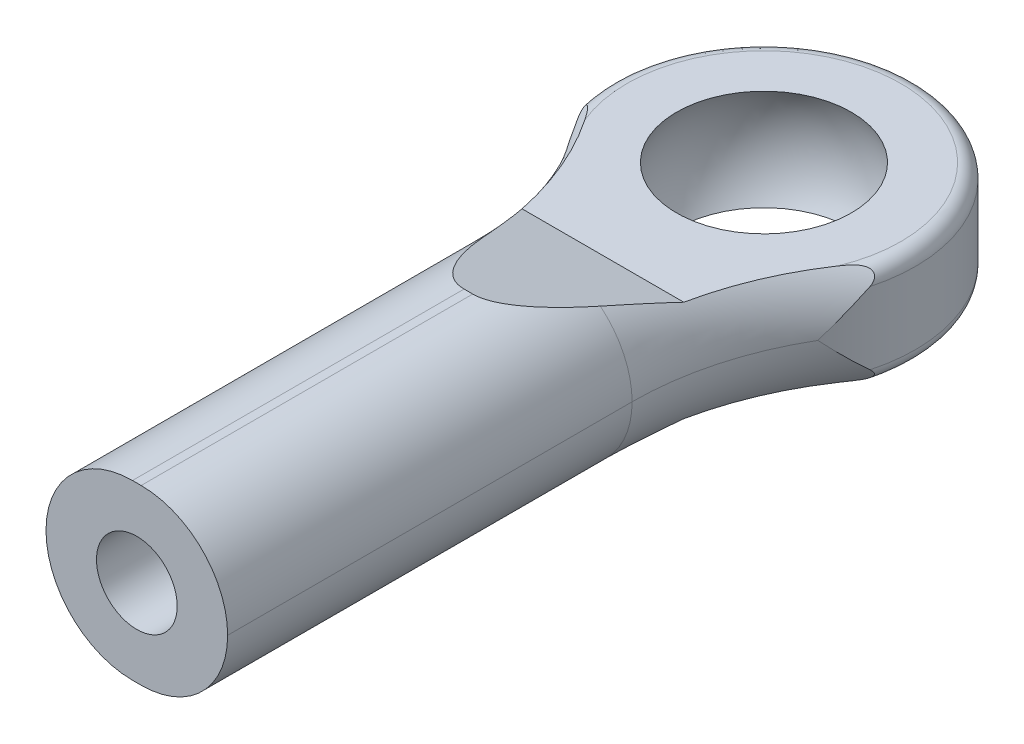
from build123d import *

# Parameters (mm, degrees)
BOSS_EXTRUDE1_DEPTH = 3
CUT_EXTRUDE1_START  = -1.25
CUT_EXTRUDE1_DEPTH  = 1.25
FILLET2_R           = 10
CHAMFER1_SIZE       = 5
CHAMFER1_SIZE_2     = 1.339745962
FILLET3_START       = 7.722693831
FILLET3_DEPTH       = 14.027306169
FILLET3_2_ANGLE     = 41.120463
FILLET3_3_ANGLE     = 41.120463
FILLET4_R           = 0.5
SKETCH10_R          = 1.4
CUT_EXTRUDE3_DEPTH  = 10


with BuildPart() as part:
    # Sketch1 → Boss-Extrude1 (new body)
    with BuildSketch(Plane(origin=(0, 0, 0), x_dir=(1, 0, 0), z_dir=(0, 1, 0))):
        with BuildLine():
            Line((-3.15, -4.2), (-3.15, -21.75))
            Line((-3.15, -21.75), (3.15, -21.75))
            Line((3.15, -21.75), (3.15, -4.2))
            ThreePointArc((3.15, -4.2), (0, 5.25), (-3.15, -4.2))
        make_face()
    extrude(amount=BOSS_EXTRUDE1_DEPTH)

    # Sketch2 → Cut-Extrude1 (cut)
    with BuildSketch(Plane(origin=(0, 3, 0), x_dir=(1, 0, 0), z_dir=(0, 1, 0)).offset(CUT_EXTRUDE1_START)):
        with BuildLine():
            Line((-3.15, -4.2), (-3.15, -5.25))
            Line((-3.15, -5.25), (3.15, -5.25))
            Line((3.15, -5.25), (3.15, -4.2))
            ThreePointArc((3.15, -4.2), (0, 5.25), (-3.15, -4.2))
        make_face()
    extrude(amount=CUT_EXTRUDE1_DEPTH, mode=Mode.SUBTRACT)

    # Cut-Sweep1: sweep along a path in Sketch9
    with BuildLine(Plane(origin=(0, 0, 0), x_dir=(1, 0, 0), z_dir=(0, 1, 0))) as cut_sweep1_path:
        CenterArc((0, 0), 3.5, 0, 360)
    # Sketch8 → Cut-Sweep1 (sweep, cut)
    with BuildSketch(Plane(origin=(0, 0, 0), x_dir=(0, 0, -1), z_dir=(1, 0, 0))):
        with BuildLine():
            Line((0, 3.5), (0, 0))
            Line((0, 0), (3.5, 0))
            ThreePointArc((3.5, 0), (2.474873734, 2.474873734), (0, 3.5))
        make_face()
    sweep(path=cut_sweep1_path.line, mode=Mode.SUBTRACT)

    # Fillet2
    # the kernel refuses this fillet: 10 mm, written as the material it adds along each edge
    with BuildSketch(Plane(origin=(-3.15, 0, 4.2), x_dir=(0, 0, 1), z_dir=(0, 1, 0))) as fillet2_piece_1_section:
        with BuildLine():
            CenterArc((3.522693831, -10), FILLET2_R, 90, 30.424740483)
            ThreePointArc((-1.541367698, -1.37704918), (-0.702247096, -0.765127664), (0, 0))
            Line((0, 0), (3.522693831, 0))
        make_face()
    fillet2_piece_1 = extrude(amount=1.75, mode=Mode.PRIVATE)
    fillet2_piece_1 = split(fillet2_piece_1, bisect_by=Plane(origin=(-3.15, 0, 5.25), z_dir=(0, 0, 1)), keep=Keep.TOP, mode=Mode.PRIVATE)
    add(fillet2_piece_1)
    with BuildSketch(Plane(origin=(-3.15, 0, 4.2), x_dir=(0, 0, 1), z_dir=(0, 1, 0))) as fillet2_piece_2_section:
        with BuildLine():
            CenterArc((3.522693831, -10), FILLET2_R, 90, 30.424740483)
            ThreePointArc((-1.541367698, -1.37704918), (-0.702247096, -0.765127664), (0, 0))
            Line((0, 0), (3.522693831, 0))
        make_face()
    fillet2_piece_2 = extrude(amount=1.75, mode=Mode.PRIVATE)
    fillet2_piece_2 = split(fillet2_piece_2, bisect_by=Plane(origin=(-3.15, 0, 5.25), z_dir=(0, 0, -1)), keep=Keep.TOP, mode=Mode.PRIVATE)
    add(fillet2_piece_2)
    with BuildSketch(Plane(origin=(-3.15, 0, 4.2), x_dir=(0, 0, 1), z_dir=(0, 1, 0))) as fillet2_piece_3_section:
        with BuildLine():
            CenterArc((3.522693831, -10), FILLET2_R, 90, 30.424740483)
            ThreePointArc((-1.541367698, -1.37704918), (-0.702247096, -0.765127664), (0, 0))
            Line((0, 0), (3.522693831, 0))
        make_face()
    fillet2_piece_3 = extrude(amount=10.556734576, mode=Mode.PRIVATE)
    fillet2_piece_3 = split(fillet2_piece_3, bisect_by=Plane(origin=(-3.15, 3, 4.2), z_dir=(0, -1, 0)), keep=Keep.TOP, mode=Mode.PRIVATE)
    fillet2_piece_3 = split(fillet2_piece_3, bisect_by=Plane(origin=(-3.15, 0, 5.25), z_dir=(0, 0, 1)), keep=Keep.TOP, mode=Mode.PRIVATE)
    fillet2_piece_3 = split(fillet2_piece_3, bisect_by=Plane(origin=(-3.15, 1.75, 4.2), z_dir=(0, 1, 0)), keep=Keep.TOP, mode=Mode.PRIVATE)
    add(fillet2_piece_3)
    with BuildSketch(Plane(origin=(3.15, 0, 4.2), x_dir=(0.6662386483372984, 0, -0.7457386026361313), z_dir=(0, 1, 0))) as fillet2_piece_4_section:
        with BuildLine():
            CenterArc((4.035377709, -9.804340803), FILLET2_R, 101.352680936, 30.424740483)
            Line((-2.627008775, -2.346954776), (0, 0))
            ThreePointArc((0, 0), (1.033450389, -0.102721079), (2.066900778, 0))
        make_face()
    fillet2_piece_4 = extrude(amount=1.75, mode=Mode.PRIVATE)
    fillet2_piece_4 = split(fillet2_piece_4, bisect_by=Plane(origin=(3.15, 0, 5.25), z_dir=(0, 0, -1)), keep=Keep.TOP, mode=Mode.PRIVATE)
    add(fillet2_piece_4)
    with BuildSketch(Plane(origin=(3.15, 0, 4.2), x_dir=(0.6662386483372984, 0, -0.7457386026361313), z_dir=(0, 1, 0))) as fillet2_piece_5_section:
        with BuildLine():
            CenterArc((4.035377709, -9.804340803), FILLET2_R, 101.352680936, 30.424740483)
            Line((-2.627008775, -2.346954776), (0, 0))
            ThreePointArc((0, 0), (1.033450389, -0.102721079), (2.066900778, 0))
        make_face()
    fillet2_piece_5 = extrude(amount=1.75, mode=Mode.PRIVATE)
    fillet2_piece_5 = split(fillet2_piece_5, bisect_by=Plane(origin=(3.15, 0, 5.25), z_dir=(0, 0, 1)), keep=Keep.TOP, mode=Mode.PRIVATE)
    add(fillet2_piece_5)
    with BuildSketch(Plane(origin=(3.15, 0, 4.2), x_dir=(0.6662386483372984, 0, -0.7457386026361313), z_dir=(0, 1, 0))) as fillet2_piece_6_section:
        with BuildLine():
            CenterArc((4.035377709, -9.804340803), FILLET2_R, 101.352680936, 30.424740483)
            Line((-2.627008775, -2.346954776), (0, 0))
            ThreePointArc((0, 0), (1.033450389, -0.102721079), (2.066900778, 0))
        make_face()
    fillet2_piece_6 = extrude(amount=10.556734576, mode=Mode.PRIVATE)
    fillet2_piece_6 = split(fillet2_piece_6, bisect_by=Plane(origin=(3.15, 3, 4.2), z_dir=(0, -1, 0)), keep=Keep.TOP, mode=Mode.PRIVATE)
    fillet2_piece_6 = split(fillet2_piece_6, bisect_by=Plane(origin=(3.15, 0, 5.25), z_dir=(0, 0, 1)), keep=Keep.TOP, mode=Mode.PRIVATE)
    fillet2_piece_6 = split(fillet2_piece_6, bisect_by=Plane(origin=(3.15, 1.75, 4.2), z_dir=(0, 1, 0)), keep=Keep.TOP, mode=Mode.PRIVATE)
    add(fillet2_piece_6)

    # Chamfer1
    # the kernel refuses this chamfer: 5, 1.339745962 mm, written as the material it takes off along each edge
    with BuildSketch(Plane(origin=(16.444140104, 3, 5.25), x_dir=(0, 0, 1), z_dir=(-1, 0, 0))) as chamfer1_piece_1_section:
        Polygon((CHAMFER1_SIZE, 0), (0, -CHAMFER1_SIZE_2), (0, 0), align=None)
    chamfer1_piece_1 = extrude(amount=32.888280208, mode=Mode.PRIVATE)
    chamfer1_piece_1 = split(chamfer1_piece_1, bisect_by=Plane(origin=(16.444140104, 1.75, 5.25), z_dir=(0, 1, 0)), keep=Keep.TOP, mode=Mode.PRIVATE)
    add(chamfer1_piece_1, mode=Mode.SUBTRACT)

    # Fillet3: read off the stored shape, not the designer's step
    # Fillet3 outline → Fillet3 (cut)
    with BuildSketch(Plane.XY.offset(FILLET3_START)):
        with BuildLine():
            ThreePointArc((-3.15, 0), (-2.271320344, 2.121320344), (-0.15, 3))
            Line((-0.15, 3), (-3.15, 3))
            Line((-3.15, 3), (-3.15, 0))
        make_face()
        with BuildLine():
            Line((3.15, 0), (3.15, 3))
            Line((3.15, 3), (0.15, 3))
            ThreePointArc((0.15, 3), (2.271320344, 2.121320344), (3.15, 0))
        make_face()
    extrude(amount=FILLET3_DEPTH, mode=Mode.SUBTRACT)

    # Fillet3 2 outline → Fillet3 2 (revolve, cut)
    with BuildSketch(Plane(origin=(-13.15, 0, 7.722693831), x_dir=(1, 0, 0), z_dir=(0, 0, 1))):
        with BuildLine():
            ThreePointArc((10, 0), (10.289308449, 1.285360382), (11.101434209, 2.322810353))
            Line((11.101434209, 2.322810353), (10, 2.322810353))
            Line((10, 2.322810353), (10, 0))
        make_face()
    revolve(axis=Axis((-13.15, 0, 7.722693831), (0, 1, 0)), revolution_arc=FILLET3_2_ANGLE, mode=Mode.SUBTRACT)

    # Fillet3 3 outline → Fillet3 3 (revolve, cut)
    with BuildSketch(Plane(origin=(13.15, 0, 7.722693831), x_dir=(-0.7533285646584991, 0, -0.6576443367577688), z_dir=(0.6576443367577688, 0, -0.7533285646584991))):
        with BuildLine():
            ThreePointArc((10, 0), (10.289308449, 1.285360382), (11.101434209, 2.322810353))
            Line((11.101434209, 2.322810353), (10, 2.322810353))
            Line((10, 2.322810353), (10, 0))
        make_face()
    revolve(axis=Axis((13.15, 0, 7.722693831), (0, 1, 0)), revolution_arc=FILLET3_3_ANGLE, mode=Mode.SUBTRACT)

    # Fillet4
    fillet4_edges = [part.edges().sort_by_distance(p)[0] for p in [
        (-1e-09, 1.75, -5.25),
    ]]
    fillet(fillet4_edges, radius=FILLET4_R)

    # Mirror2: read off the stored shape, not the designer's step
    # Mirror2: part across plane


with BuildPart() as part_1:
    add(part.part)
    add(part.part.mirror(Plane.ZX))

    # Sketch10 → Cut-Extrude3 (cut)
    with BuildSketch(Plane.XY.offset(21.75)):
        Circle(SKETCH10_R)
    extrude(amount=-CUT_EXTRUDE3_DEPTH, mode=Mode.SUBTRACT)


solid = part_1.part
